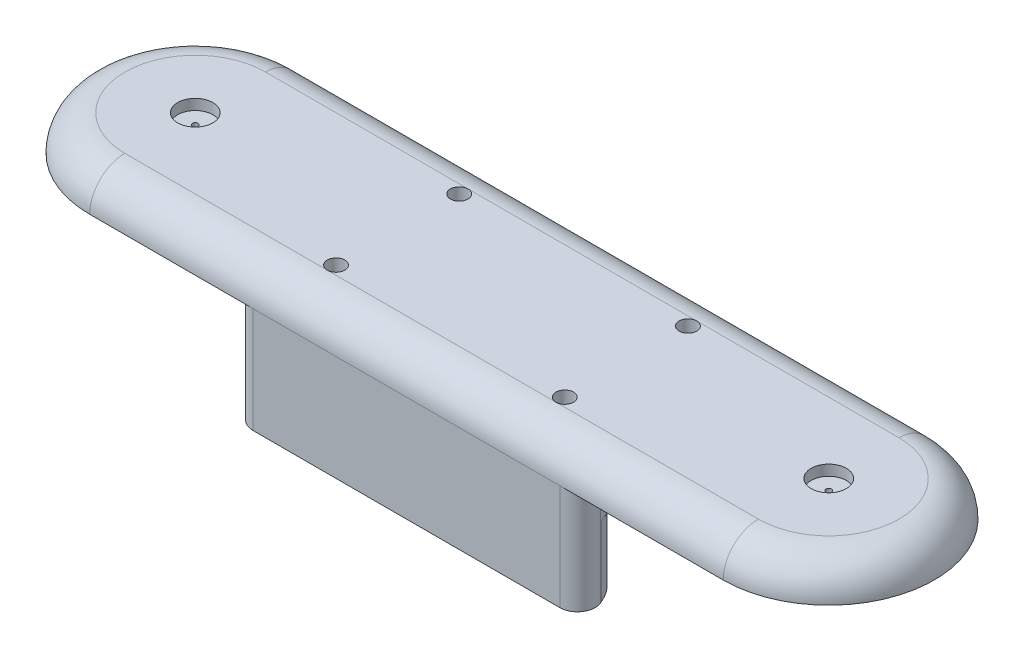
from build123d import *

# Parameters (mm, degrees)
BOSS_EXTRUDE1_DEPTH     = 40
FILLET1_R               = 10
CUT_EXTRUDE1_DEPTH      = 30
SKETCH4_R               = 10
BOSS_EXTRUDE3_DEPTH     = 10
CUT_EXTRUDE2_REACH      = 181.038
CUT_EXTRUDE2_END_RADIUS = 60
SKETCH5_W               = 20
SKETCH5_H               = 40
FILLET2_R               = 5
CUT_EXTRUDE3_REACH      = 153.142
SKETCH6_R               = 1
SKETCH7_R               = 2.5
CUT_EXTRUDE4_DEPTH      = 5
CUT_EXTRUDE5_REACH      = 149.119
SKETCH8_R               = 0.8
SKETCH9_R               = 3
CUT_EXTRUDE6_DEPTH      = 10
SKETCH11_R              = 5
CUT_EXTRUDE7_DEPTH      = 3
SKETCH12_R              = 6
CUT_EXTRUDE8_DEPTH      = 20
FILLET3_R               = 15


with BuildPart() as part:
    # Sketch1 → Boss-Extrude1 (new body)
    with BuildSketch(Plane(origin=(0, 0, 0), x_dir=(1, 0, 0), z_dir=(0, 1, 0))):
        with BuildLine():
            Line((-67.694698117, 31.515169882), (112.305301883, 31.515169882))
            ThreePointArc((112.305301883, 31.515169882), (142.305301883, 1.515169882), (112.305301883, -28.484830118))
            Line((112.305301883, -28.484830118), (-67.694698117, -28.484830118))
            ThreePointArc((-67.694698117, -28.484830118), (-97.694698117, 1.515169882), (-67.694698117, 31.515169882))
        make_face()
    extrude(amount=BOSS_EXTRUDE1_DEPTH)

    # Fillet1
    fillet1_edges = [part.edges().sort_by_distance(p)[0] for p in [
        (142.305301883, 40, -1.515169882),
        (22.305301883, 40, -31.515169882),
        (-97.694698117, 40, -1.515169882),
        (22.305301883, 40, 28.484830118),
    ]]
    fillet(fillet1_edges, radius=FILLET1_R)

    # Sketch3 → Cut-Extrude1 (cut)
    with BuildSketch(Plane.XZ):
        with BuildLine():
            Line((73.949041486, -31.515169882), (148.949041486, -31.515169882))
            Line((148.949041486, -31.515169882), (148.949041486, 28.484830118))
            Line((148.949041486, 28.484830118), (73.949041486, 28.484830118))
            ThreePointArc((73.949041486, 28.484830118), (65.910565713, -1.515169882), (73.949041486, -31.515169882))
        make_face()
        with BuildLine():
            Line((-29.33843772, 28.484830118), (-104.33843772, 28.484830118))
            Line((-104.33843772, 28.484830118), (-104.33843772, -31.515169882))
            Line((-104.33843772, -31.515169882), (-29.33843772, -31.515169882))
            ThreePointArc((-29.33843772, -31.515169882), (-21.299961947, -1.515169882), (-29.33843772, 28.484830118))
        make_face()
    extrude(amount=-CUT_EXTRUDE1_DEPTH, mode=Mode.SUBTRACT)

    # Sketch4 → Boss-Extrude3 (add)
    with BuildSketch(Plane(origin=(0, 30, 0), x_dir=(-1, 0, 0), z_dir=(0, -1, 0))):
        with Locations(Location((-112.305301883, 1.515169882, 0), (0, 0, 90))):
            Circle(SKETCH4_R)
        with Locations(Location((67.694698117, 1.515169882, 0), (0, 0, 270))):
            Circle(SKETCH4_R)
    extrude(amount=BOSS_EXTRUDE3_DEPTH)

    # Cut-Extrude2: up to this cylinder (the profile starts outside it)
    cut_extrude2_end = Plane(origin=(-81.299961947, 0, -1.515169882), z_dir=(0, -1, 0)) * Cylinder(CUT_EXTRUDE2_END_RADIUS, 483.076, mode=Mode.PRIVATE)
    # Sketch5 → Cut-Extrude2 (cut, up to the surface)
    with BuildSketch(Plane(origin=(73.949041486, 0, 0), x_dir=(0, 0, -1), z_dir=(1, 0, 0)), mode=Mode.PRIVATE) as cut_extrude2_sk1:
        with Locations((1.515169882, 0)):
            Rectangle(SKETCH5_W, SKETCH5_H)
    cut_extrude2_tool1 = extrude(cut_extrude2_sk1.sketch, amount=-CUT_EXTRUDE2_REACH, mode=Mode.PRIVATE) - cut_extrude2_end
    add(cut_extrude2_tool1.solids().sort_by_distance((73.949041, 0, -1.51517))[0], mode=Mode.SUBTRACT)

    # Fillet2
    # the kernel refuses this fillet: 5 mm, written as the material it takes off along each edge
    with BuildSketch(Plane(origin=(-29.33843772, -20.096189432, 28.484830118), x_dir=(0.44322659401027775, 0, -0.8964096085841831), z_dir=(0, 1, 0))) as fillet2_piece_1:
        with BuildLine():
            CenterArc((8.044914281, -4.989633951), FILLET2_R, 93.690067526, 112.619864948)
            Line((3.562866238, -7.205766921), (0, 0))
            ThreePointArc((0, 0), (3.861558855, -0.124392586), (7.72311771, 0))
        make_face()
    extrude(amount=50.096189432, mode=Mode.SUBTRACT)
    with BuildSketch(Plane(origin=(-29.33843772, -20.096189432, -31.515169882), x_dir=(1, 0, 0), z_dir=(0, 1, 0))) as fillet2_piece_2:
        with BuildLine():
            CenterArc((8.038475773, -5), FILLET2_R, 90, 112.619864948)
            ThreePointArc((3.423091158, -6.923076923), (1.823052288, -3.406404359), (0, 0))
            Line((0, 0), (8.038475773, 0))
        make_face()
    extrude(amount=50.096189432, mode=Mode.SUBTRACT)
    with BuildSketch(Plane(origin=(73.949041486, -20.096189432, -31.515169882), x_dir=(-1, 0, 0), z_dir=(0, 1, 0))) as fillet2_piece_3:
        with BuildLine():
            CenterArc((8.038475773, 5), FILLET2_R, 157.380135052, 112.619864948)
            ThreePointArc((3.423091158, 6.923076923), (1.823052288, 3.406404359), (0, 0))
            Line((0, 0), (8.038475773, 0))
        make_face()
    extrude(amount=50.096189432, mode=Mode.SUBTRACT)
    with BuildSketch(Plane(origin=(73.949041486, -20.096189432, 28.484830118), x_dir=(-0.4432265940102763, 0, -0.8964096085841838), z_dir=(0, 1, 0))) as fillet2_piece_4:
        with BuildLine():
            CenterArc((8.044914281, 4.989633951), FILLET2_R, 153.690067526, 112.619864948)
            Line((3.562866238, 7.205766921), (0, 0))
            ThreePointArc((0, 0), (3.861558855, 0.124392586), (7.72311771, 0))
        make_face()
    extrude(amount=50.096189432, mode=Mode.SUBTRACT)

    # Sketch6 → Cut-Extrude3 (cut, up to next)
    with BuildSketch(Plane(origin=(0, 0, 0), x_dir=(-1, 0, 0), z_dir=(0, -1, 0)), mode=Mode.PRIVATE) as cut_extrude3_sk1:
        with Locations(Location((10.194698117, -15.984830118, 0), (0, 0, 90))):
            Circle(SKETCH6_R)
    cut_extrude3_tool1 = extrude(cut_extrude3_sk1.sketch, amount=-CUT_EXTRUDE3_REACH, mode=Mode.PRIVATE) & part.part
    # Sketch6 → Cut-Extrude3 (cut, up to next)
    with BuildSketch(Plane(origin=(0, 0, 0), x_dir=(-1, 0, 0), z_dir=(0, -1, 0)), mode=Mode.PRIVATE) as cut_extrude3_sk2:
        with Locations(Location((-54.805301883, -15.984830118, 0), (0, 0, 90))):
            Circle(SKETCH6_R)
    cut_extrude3_tool2 = extrude(cut_extrude3_sk2.sketch, amount=-CUT_EXTRUDE3_REACH, mode=Mode.PRIVATE) & part.part
    # Sketch6 → Cut-Extrude3 (cut, up to next)
    with BuildSketch(Plane(origin=(0, 0, 0), x_dir=(-1, 0, 0), z_dir=(0, -1, 0)), mode=Mode.PRIVATE) as cut_extrude3_sk3:
        with Locations(Location((-54.805301883, 19.015169882, 0), (0, 0, 90))):
            Circle(SKETCH6_R)
    cut_extrude3_tool3 = extrude(cut_extrude3_sk3.sketch, amount=-CUT_EXTRUDE3_REACH, mode=Mode.PRIVATE) & part.part
    # Sketch6 → Cut-Extrude3 (cut, up to next)
    with BuildSketch(Plane(origin=(0, 0, 0), x_dir=(-1, 0, 0), z_dir=(0, -1, 0)), mode=Mode.PRIVATE) as cut_extrude3_sk4:
        with Locations(Location((10.194698117, 19.015169882, 0), (0, 0, 90))):
            Circle(SKETCH6_R)
    cut_extrude3_tool4 = extrude(cut_extrude3_sk4.sketch, amount=-CUT_EXTRUDE3_REACH, mode=Mode.PRIVATE) & part.part
    add(cut_extrude3_tool1.solids().sort_by_distance((-10.194698, 0, 15.98483))[0], mode=Mode.SUBTRACT)
    add(cut_extrude3_tool2.solids().sort_by_distance((54.805302, 0, 15.98483))[0], mode=Mode.SUBTRACT)
    add(cut_extrude3_tool3.solids().sort_by_distance((54.805302, 0, -19.01517))[0], mode=Mode.SUBTRACT)
    add(cut_extrude3_tool4.solids().sort_by_distance((-10.194698, 0, -19.01517))[0], mode=Mode.SUBTRACT)

    # Sketch7 → Cut-Extrude4 (cut)
    with BuildSketch(Plane(origin=(0, 40, 0), x_dir=(1, 0, 0), z_dir=(0, 1, 0))):
        with Locations(Location((-10.194698117, 19.015169882, 0), (0, 0, 270))):
            Circle(SKETCH7_R)
        with Locations(Location((-10.194698117, -15.984830118, 0), (0, 0, 270))):
            Circle(SKETCH7_R)
        with Locations(Location((54.805301883, -15.984830118, 0), (0, 0, 270))):
            Circle(SKETCH7_R)
        with Locations(Location((54.805301883, 19.015169882, 0), (0, 0, 270))):
            Circle(SKETCH7_R)
    extrude(amount=-CUT_EXTRUDE4_DEPTH, mode=Mode.SUBTRACT)

    # Sketch8 → Cut-Extrude5 (cut, up to next)
    with BuildSketch(Plane(origin=(0, 20, 0), x_dir=(-1, 0, 0), z_dir=(0, -1, 0)), mode=Mode.PRIVATE) as cut_extrude5_sk1:
        with Locations(Location((67.694698117, 1.515169882, 0), (0, 0, 90))):
            Circle(SKETCH8_R)
    cut_extrude5_tool1 = extrude(cut_extrude5_sk1.sketch, amount=-CUT_EXTRUDE5_REACH, mode=Mode.PRIVATE) & part.part
    # Sketch8 → Cut-Extrude5 (cut, up to next)
    with BuildSketch(Plane(origin=(0, 20, 0), x_dir=(-1, 0, 0), z_dir=(0, -1, 0)), mode=Mode.PRIVATE) as cut_extrude5_sk2:
        with Locations(Location((-112.305301883, 1.515169882, 0), (0, 0, 90))):
            Circle(SKETCH8_R)
    cut_extrude5_tool2 = extrude(cut_extrude5_sk2.sketch, amount=-CUT_EXTRUDE5_REACH, mode=Mode.PRIVATE) & part.part
    add(cut_extrude5_tool1.solids().sort_by_distance((-67.694698, 20, -1.51517))[0], mode=Mode.SUBTRACT)
    add(cut_extrude5_tool2.solids().sort_by_distance((112.305302, 20, -1.51517))[0], mode=Mode.SUBTRACT)

    # Sketch9 → Cut-Extrude6 (cut)
    with BuildSketch(Plane(origin=(0, 20, 0), x_dir=(-1, 0, 0), z_dir=(0, -1, 0))):
        with Locations(Location((67.694698117, 1.515169882, 0), (0, 0, 90))):
            Circle(SKETCH9_R)
        with Locations(Location((-112.305301883, 1.515169882, 0), (0, 0, 90))):
            Circle(SKETCH9_R)
    extrude(amount=-CUT_EXTRUDE6_DEPTH, mode=Mode.SUBTRACT)

    # Sketch11 → Cut-Extrude7 (cut)
    with BuildSketch(Plane(origin=(0, 40, 0), x_dir=(1, 0, 0), z_dir=(0, 1, 0))):
        with Locations(Location((-67.694698117, 1.515169882, 0), (0, 0, 270))):
            Circle(SKETCH11_R)
        with Locations(Location((112.305301883, 1.515169882, 0), (0, 0, 270))):
            Circle(SKETCH11_R)
    extrude(amount=-CUT_EXTRUDE7_DEPTH, mode=Mode.SUBTRACT)

    # Sketch12 → Cut-Extrude8 (cut)
    with BuildSketch(Plane(origin=(0, 0, 0), x_dir=(-1, 0, 0), z_dir=(0, -1, 0))):
        with Locations((22.139164116, -8.484830118)):
            Circle(SKETCH12_R)
        with Locations((22.139164116, 11.515169882)):
            Circle(SKETCH12_R)
        with Locations((-66.749767882, 11.515169882)):
            Circle(SKETCH12_R)
        with Locations((-66.749767882, -8.484830118)):
            Circle(SKETCH12_R)
    extrude(amount=-CUT_EXTRUDE8_DEPTH, mode=Mode.SUBTRACT)

    # Fillet3
    fillet3_edges = [part.edges().sort_by_distance(p)[0] for p in [
        (68.044321089, 10, 14.343510174),
        (60.749767882, 10, 8.484830118),
        (68.044321089, 10, -17.373849938),
        (60.749767882, 10, -11.515169882),
        (-23.433717323, 10, -17.373849938),
        (-16.139164116, 10, -11.515169882),
        (-23.433717323, 10, 14.343510174),
        (-16.139164116, 10, 8.484830118),
    ]]
    fillet(fillet3_edges, radius=FILLET3_R)


solid = part.part
